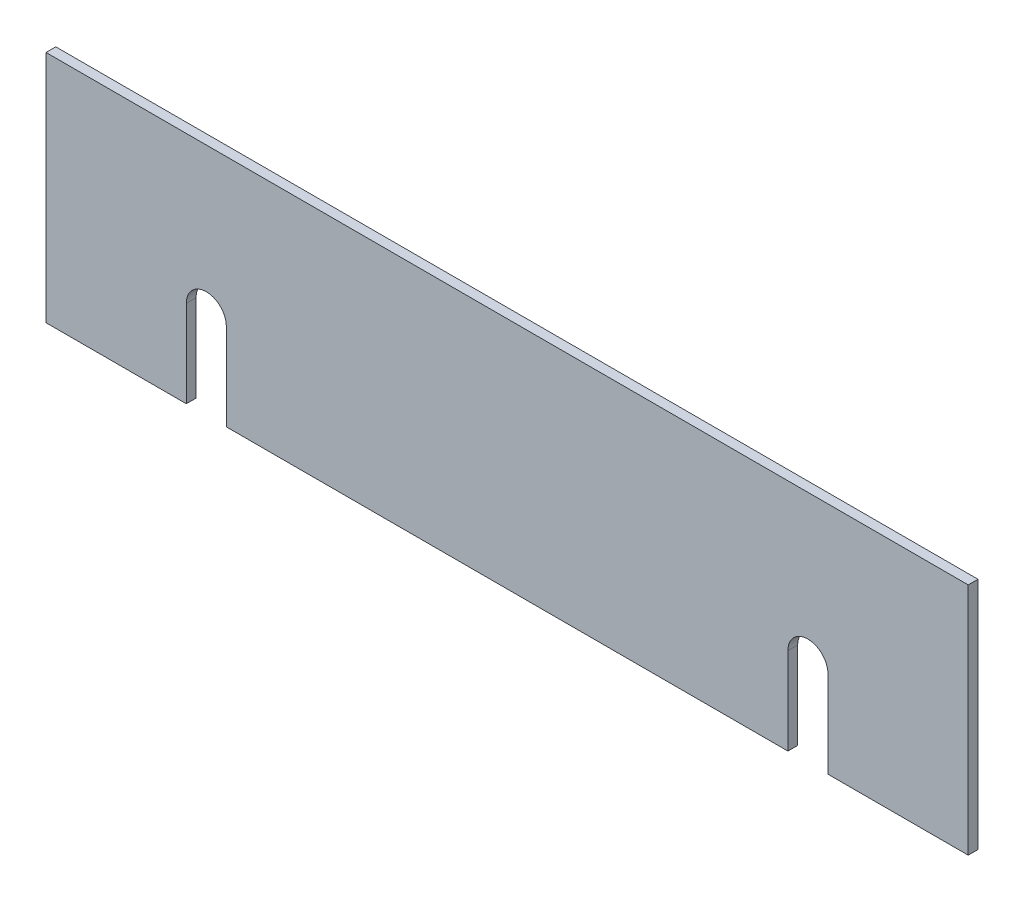
from build123d import *

# Parameters (mm, degrees)
SKETCH1_W           = 299.7
SKETCH1_H           = 76.075
BOSS_EXTRUDE1_DEPTH = 3.175
CUT_EXTRUDE1_DEPTH  = 155.634907221


with BuildPart() as part:
    # Sketch1 → Boss-Extrude1 (new body)
    with BuildSketch(Plane.XY):
        Rectangle(SKETCH1_W, SKETCH1_H)
    extrude(amount=BOSS_EXTRUDE1_DEPTH)

    # Sketch3 → Cut-Extrude1 (cut, through all)
    with BuildSketch(Plane(origin=(0, 0, 0), x_dir=(-1, 0, 0), z_dir=(0, 0, -1))):
        with BuildLine():
            Line((-104.25, -38.0375), (-91.25, -38.0375))
            Line((-91.25, -38.0375), (-91.25, -9.7625))
            ThreePointArc((-91.25, -9.7625), (-97.75, -3.2625), (-104.25, -9.7625))
            Line((-104.25, -9.7625), (-104.25, -38.0375))
        make_face()
        with BuildLine():
            ThreePointArc((104.25, -9.7625), (97.75, -3.2625), (91.25, -9.7625))
            Line((91.25, -9.7625), (91.25, -38.0375))
            Line((91.25, -38.0375), (104.25, -38.0375))
            Line((104.25, -38.0375), (104.25, -9.7625))
        make_face()
    extrude(amount=-CUT_EXTRUDE1_DEPTH, mode=Mode.SUBTRACT)


solid = part.part
